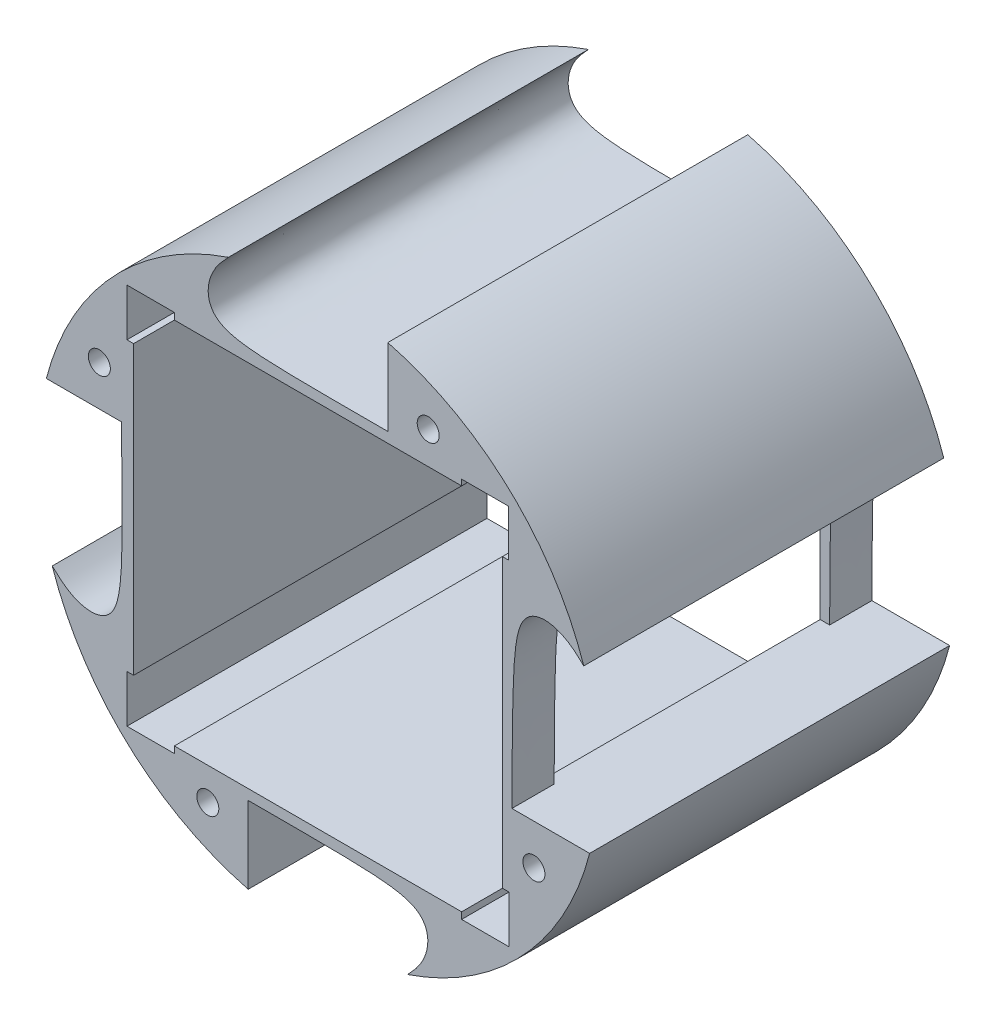
from build123d import *

# Parameters (mm, degrees)
BOSS_EXTRUDE3_OUTLINE_R = 3
BOSS_EXTRUDE3_DEPTH     = 98
SKETCH3_R               = 3
BOSS_EXTRUDE4_DEPTH     = 5
CUT_EXTRUDE6_DEPTH      = 144.320079016
CUT_EXTRUDE6_DEPTH_BACK = 144.320079016
CUT_EXTRUDE9_DEPTH      = 98
SKETCH10_W              = 0.4
SKETCH10_H              = 1.8
SKETCH10_W_2            = 1.8
SKETCH10_H_2            = 0.4
SKETCH10_H_3            = 1.6
SKETCH10_W_3            = 1.6
BOSS_EXTRUDE5_DEPTH     = 98
SKETCH11_W              = 75
SKETCH11_H              = 43.392810524
CUT_EXTRUDE10_DEPTH     = 10


# Read off the part's stored shape, not the designer's step: Boss-Extrude3
with BuildPart() as part:
    # Boss-Extrude3 outline → Boss-Extrude3 (new body)
    with BuildSketch(Plane.XY):
        with BuildLine():
            ThreePointArc((-24.392810524, 72.348554199), (-55.939709188, 51.962211615), (-73.948106805, 19))
            Line((-73.948106805, 19), (-53.527635725, 19))
            add(Edge.make_bspline(
                [(-72.348554199, -24.392810524), (-69.541086329, -27.040667073), (-67.428574969, -29.089162938), (-64.355831171, -30.241441862), (-60.963009895, -31.073643307), (-59.042545022, -30.561519341), (-56.673971678, -29.217193929), (-54.241382838, -27.488775543), (-53, -25.105954954), (-53, -17.37432721), (-53.527635725, 19)],
                knots=[0, 0, 0, 0, 0, 0, 0, 0, 0, 0, 0, 1, 1, 1, 1, 1, 1, 1, 1, 1, 1, 1], degree=10))
            ThreePointArc((-72.348554199, -24.392810524), (-51.962211615, -55.939709188), (-19, -73.948106805))
            Line((-19, -73.948106805), (-19, -53))
            add(Edge.make_bspline(
                [(24.392810524, -72.348554199), (27.040667073, -69.541086329), (29.089162938, -67.428574969), (30.241441862, -64.355831171), (31.073643307, -60.963009895), (30.561519341, -59.042545022), (29.217193929, -56.673971678), (27.488775543, -54.241382838), (25.105954954, -53), (17.37432721, -53), (-19, -53)],
                knots=[0, 0, 0, 0, 0, 0, 0, 0, 0, 0, 0, 1, 1, 1, 1, 1, 1, 1, 1, 1, 1, 1], degree=10))
            ThreePointArc((24.392810524, -72.348554199), (55.939709188, -51.962211615), (73.948106805, -19))
            Line((73.948106805, -19), (52.782560411, -19))
            add(Edge.make_bspline(
                [(72.348554199, 24.392810524), (69.541086329, 27.040667073), (67.428574969, 29.089162938), (64.355831171, 30.241441862), (60.963009895, 31.073643307), (59.042545022, 30.561519341), (56.673971678, 29.217193929), (54.241382838, 27.488775543), (53, 25.105954954), (53, 17.37432721), (52.782560411, -19)],
                knots=[0, 0, 0, 0, 0, 0, 0, 0, 0, 0, 0, 1, 1, 1, 1, 1, 1, 1, 1, 1, 1, 1], degree=10))
            ThreePointArc((72.348554199, 24.392810524), (51.962211615, 55.939709188), (19, 73.948106805))
            Line((19, 73.948106805), (19, 53))
            add(Edge.make_bspline(
                [(-24.392810524, 72.348554199), (-27.040667073, 69.541086329), (-29.089162938, 67.428574969), (-30.241441862, 64.355831171), (-31.073643307, 60.963009895), (-30.561519341, 59.042545022), (-29.217193929, 56.673971678), (-27.488775543, 54.241382838), (-25.105954954, 53), (-17.37432721, 53), (19, 53)],
                knots=[0, 0, 0, 0, 0, 0, 0, 0, 0, 0, 0, 1, 1, 1, 1, 1, 1, 1, 1, 1, 1, 1], degree=10))
        make_face()
        with Locations((-30, -59)):
            Circle(BOSS_EXTRUDE3_OUTLINE_R, mode=Mode.SUBTRACT)
        with Locations((58.782560411, -30)):
            Circle(BOSS_EXTRUDE3_OUTLINE_R, mode=Mode.SUBTRACT)
        with Locations((-59.527635725, 30)):
            Circle(BOSS_EXTRUDE3_OUTLINE_R, mode=Mode.SUBTRACT)
        Polygon((-38.9, -51.6), (-51.6, -51.6), (-51.6, -38.9), (-50, -38.9), (-50, 38.9), (-51.6, 38.9), (-51.6, 51.6), (-38.9, 51.6), (-38.9, 50), (38.9, 50), (38.9, 51.6), (51.6, 51.6), (51.6, 38.9), (50, 38.9), (50, -38.9), (51.6, -38.9), (51.6, -51.6), (38.9, -51.6), (38.9, -50), (-38.9, -50), align=None, mode=Mode.SUBTRACT)
        with Locations((30, 59)):
            Circle(BOSS_EXTRUDE3_OUTLINE_R, mode=Mode.SUBTRACT)
    extrude(amount=BOSS_EXTRUDE3_DEPTH)

    # Sketch3 → Boss-Extrude4 (add)
    with BuildSketch(Plane.XY.offset(98)):
        with Locations((-59.527635725, 30)):
            Circle(SKETCH3_R)
    extrude(amount=BOSS_EXTRUDE4_DEPTH)


with BuildPart() as boss_extrude4_kept_piece:
    # of the separate pieces the step leaves, the one the design keeps (boss_extrude4_pieces_kept)
    add(part.part.solids().sort_by_distance((-24.392810524, 72.348554199, 0))[0])

    # Sketch5 → Cut-Extrude6 (cut, two sides: drawn at the far end of the back side and taken through both)
    with BuildSketch(Plane.XY.offset(98).offset(-CUT_EXTRUDE6_DEPTH_BACK)):
        Polygon((38.7, 51.8), (51.8, 51.8), (51.8, 38.7), (50.2, 38.7), (50.2, -38.7), (51.8, -38.7), (51.8, -51.8), (38.7, -51.8), (38.7, -50.2), (-38.7, -50.2), (-38.7, -51.8), (-51.8, -51.8), (-51.8, -38.7), (-50.2, -38.7), (-50.2, 38.7), (-51.8, 38.7), (-51.8, 51.8), (-38.7, 51.8), (-38.7, 50.2), (38.7, 50.2), align=None)
        Polygon((-38.9, -51.6), (-51.6, -51.6), (-51.6, -38.9), (-50, -38.9), (-50, 38.9), (-51.6, 38.9), (-51.6, 51.6), (-38.9, 51.6), (-38.9, 50), (38.9, 50), (38.9, 51.6), (51.6, 51.6), (51.6, 38.9), (50, 38.9), (50, -38.9), (51.6, -38.9), (51.6, -51.6), (38.9, -51.6), (38.9, -50), (-38.9, -50), align=None, mode=Mode.SUBTRACT)
    extrude(amount=CUT_EXTRUDE6_DEPTH + CUT_EXTRUDE6_DEPTH_BACK, mode=Mode.SUBTRACT)

    # Sketch6 → Cut-Extrude9 (cut)
    with BuildSketch(Plane.XY.offset(98)):
        Polygon((-51.8, 38.7), (-51.8, 51.8), (-38.7, 51.8), (-38.7, 52), (-52, 52), (-52, 38.7), align=None)
        Polygon((-38.7, -51.8), (-51.8, -51.8), (-51.8, -38.7), (-52, -38.7), (-52, -52), (-38.7, -52), align=None)
        Polygon((51.8, -38.7), (51.8, -51.8), (38.7, -51.8), (38.7, -52), (52, -52), (52, -38.7), align=None)
        Polygon((51.8, 38.7), (51.8, 51.8), (38.7, 51.8), (38.7, 51.6), (51.6, 51.6), (51.6, 38.7), align=None)
    extrude(amount=-CUT_EXTRUDE9_DEPTH, mode=Mode.SUBTRACT)

    # Sketch10 → Boss-Extrude5 (add)
    with BuildSketch(Plane.XY.offset(98)):
        with Locations((-38.9, 51.1)):
            Rectangle(SKETCH10_W, SKETCH10_H)
        with Locations((-51.1, 38.9)):
            Rectangle(SKETCH10_W_2, SKETCH10_H_2)
        with Locations((38.9, 51)):
            Rectangle(SKETCH10_W, SKETCH10_H_3)
        with Locations((51, 38.9)):
            Rectangle(SKETCH10_W_3, SKETCH10_H_2)
        with Locations((51.1, -38.9)):
            Rectangle(SKETCH10_W_2, SKETCH10_H_2)
        with Locations((38.9, -51.1)):
            Rectangle(SKETCH10_W, SKETCH10_H)
        with Locations((-51.1, -38.9)):
            Rectangle(SKETCH10_W_2, SKETCH10_H_2)
        with Locations((-38.9, -51.1)):
            Rectangle(SKETCH10_W, SKETCH10_H)
    extrude(amount=-BOSS_EXTRUDE5_DEPTH)

    # Sketch11 → Cut-Extrude10 (cut)
    with BuildSketch(Plane.ZY.offset(-50.2)):
        with Locations((49, 2.696405262)):
            Rectangle(SKETCH11_W, SKETCH11_H)
    extrude(amount=-CUT_EXTRUDE10_DEPTH, mode=Mode.SUBTRACT)


solid = boss_extrude4_kept_piece.part
